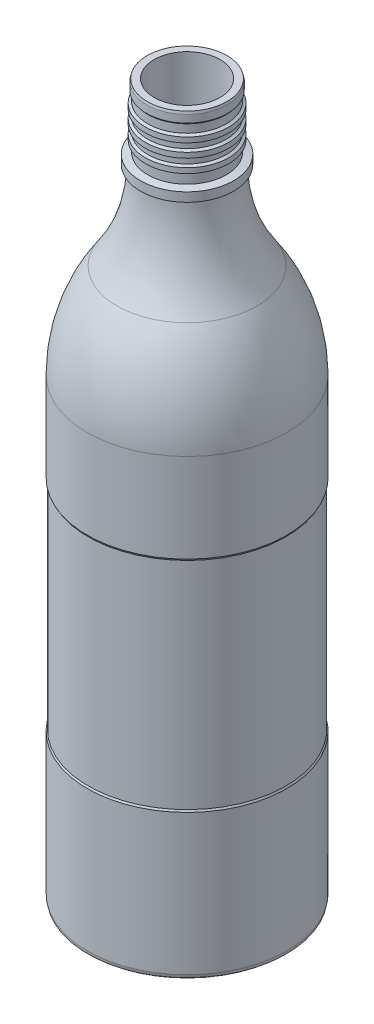
from build123d import *


with BuildPart() as part:
    # 草图1 → 旋转1 (revolve)
    with BuildSketch(Plane.XY):
        with BuildLine():
            Line((0, 8), (21, 8))
            Line((21, 8), (24.5, 7.4))
            Line((24.5, 7.4), (27.5, 5))
            Line((27.5, 5), (29, 1.2))
            Line((29, 1.2), (30.5, 0))
            Line((30.5, 0), (32.2, 0))
            Line((32.2, 0), (32.8, 0.5))
            Line((32.8, 0.5), (33, 1.5))
            Line((33, 1.5), (33, 48))
            Line((33, 48), (32.7, 48.6))
            Line((32.7, 48.6), (32.7, 120))
            Line((32.7, 120), (33, 120.6))
            Line((33, 120.6), (33, 150))
            ThreePointArc((33, 150), (30.483931966, 166.444965349), (23.165931442, 181.385325185))
            ThreePointArc((23.165931442, 181.385325185), (16.493953246, 195.006772017), (14.2, 210))
            Line((14.2, 210), (15.4, 210.4))
            Line((15.4, 210.4), (15.4, 213.4))
            Line((15.4, 213.4), (13, 213.9))
            Line((13, 213.9), (13, 217))
            Line((13, 217), (13.8, 217.5))
            Line((13.8, 217.5), (13.8, 219.2))
            Line((13.8, 219.2), (13, 219.7))
            Line((13, 219.7), (13, 221.4))
            Line((13, 221.4), (13.8, 221.9))
            Line((13.8, 221.9), (13.8, 223.6))
            Line((13.8, 223.6), (13, 224.1))
            Line((13, 224.1), (13, 225.8))
            Line((13, 225.8), (13.8, 226.3))
            Line((13.8, 226.3), (13.8, 228))
            Line((13.8, 228), (13, 228.5))
            Line((13, 228.5), (13, 231.2))
            Line((13, 231.2), (13.4, 231.7))
            Line((13.4, 231.7), (13.4, 234.2))
            Line((13.4, 234.2), (13.2, 235))
            Line((13.2, 235), (10.9, 235))
            Line((10.9, 235), (10.9, 211.2))
            ThreePointArc((10.9, 211.2), (13.501956318, 196.092944493), (21.007974956, 182.726831109))
            ThreePointArc((21.007974956, 182.726831109), (29.318991648, 167.927242035), (32.2, 151.2))
            Line((32.2, 151.2), (32.2, 120))
            Line((32.2, 120), (31.9, 119.4))
            Line((31.9, 119.4), (31.9, 48.6))
            Line((31.9, 48.6), (32.2, 48))
            Line((32.2, 48), (32.2, 12))
            Line((32.2, 12), (31.5, 10.6))
            Line((31.5, 10.6), (30, 9.6))
            Line((30, 9.6), (28, 9))
            Line((28, 9), (25, 8.8))
            Line((25, 8.8), (0, 8.8))
            Line((0, 8.8), (0, 8))
        make_face()
    revolve(axis=Axis((0, -10, 0), (0, 1, 0)))


solid = part.part
